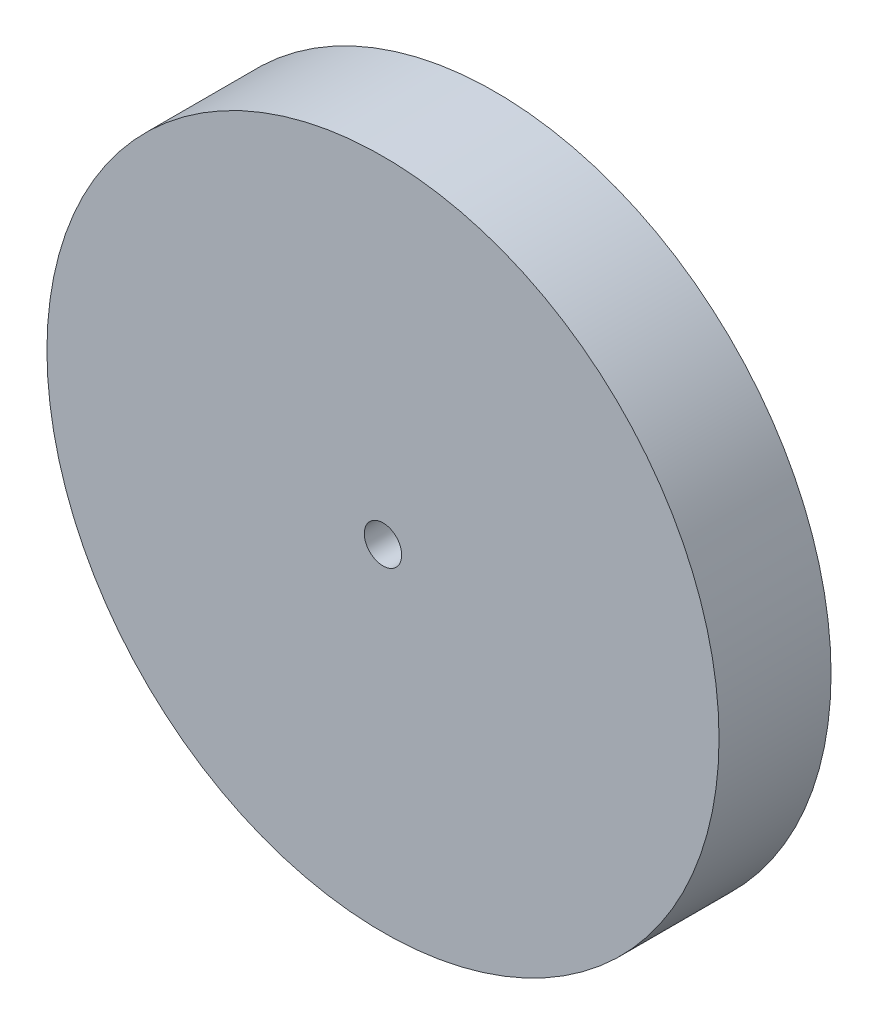
from build123d import *

# Parameters (mm, degrees)
SKETCH1_R           = 18
SKETCH1_R_2         = 1
BOSS_EXTRUDE1_DEPTH = 6


with BuildPart() as part:
    # Sketch1 → Boss-Extrude1 (new body)
    with BuildSketch(Plane.XY):
        Circle(SKETCH1_R)
        Circle(SKETCH1_R_2, mode=Mode.SUBTRACT)
    extrude(amount=BOSS_EXTRUDE1_DEPTH)


solid = part.part
